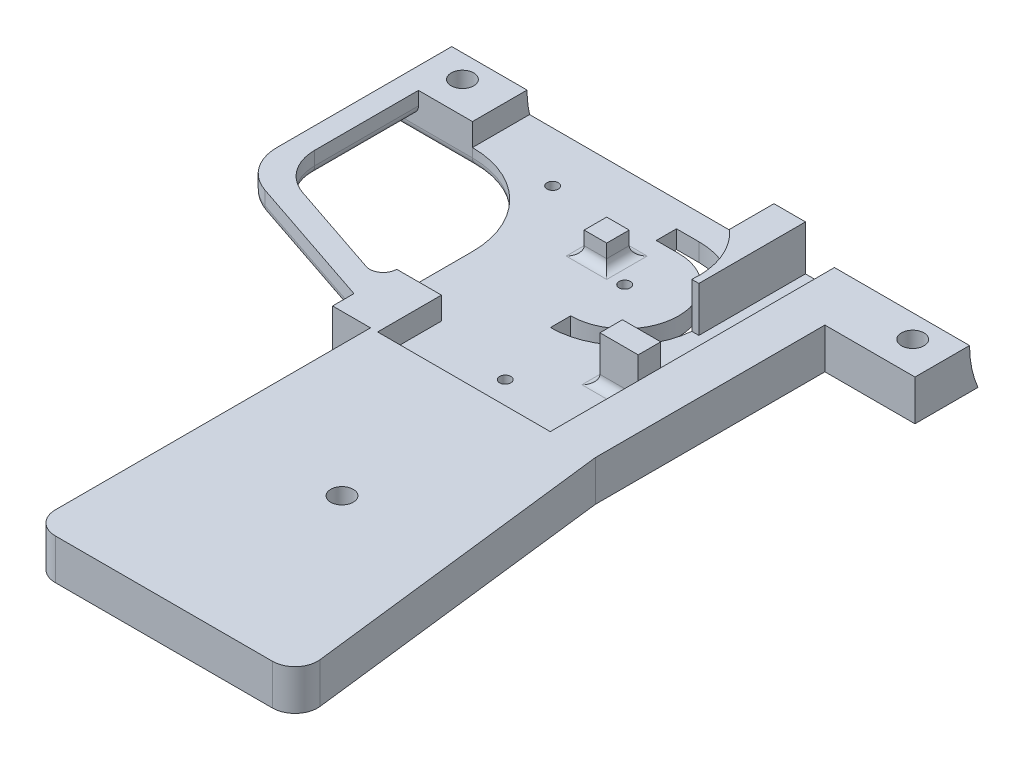
from build123d import *

# Parameters (mm, degrees)
SALIENTE_EXTRUIR1_DEPTH  = 4
REDONDEO1_R              = 20
REDONDEO2_R              = 10
REDONDEO3_R              = 3
CROQUIS2_R               = 1.25
CORTAR_EXTRUIR1_DEPTH    = 4
SALIENTE_EXTRUIR2_DEPTH  = 9
CROQUIS4_W               = 16.725121099
CROQUIS4_H               = 14
SALIENTE_EXTRUIR3_DEPTH  = 5
SALIENTE_EXTRUIR4_DEPTH  = 5
CORTAR_EXTRUIR2_START    = -4
CORTAR_EXTRUIR2_DEPTH    = 4
SALIENTE_EXTRUIR8_DEPTH  = 9
REDONDEO4_R              = 5
CORTAR_EXTRUIR3_DEPTH    = 115
CROQUIS11_R              = 2.5
CORTAR_EXTRUIR4_DEPTH    = 10
CROQUIS12_W              = 5
CROQUIS12_H              = 5
SALIENTE_EXTRUIR9_DEPTH  = 5
CROQUIS13_R              = 1.25
CROQUIS13_W              = 5
CROQUIS13_H              = 15
CORTAR_EXTRUIR5_DEPTH    = 10
SALIENTE_EXTRUIR10_START = 10
CROQUIS14_W              = 8.5
CROQUIS14_H              = 5
SALIENTE_EXTRUIR10_DEPTH = 10
REDONDEO5_R              = 2


with BuildPart() as part:
    # Croquis1 → Saliente-Extruir1 (new body)
    with BuildSketch(Plane(origin=(0, 0, 0), x_dir=(1, 0, 0), z_dir=(0, 1, 0))):
        Polygon((36.657146199, 0.467319271), (95, 0.467319271), (95, 65.467319271), (0, 65.467319271), (0, 17.557539605), (36.657146199, 5.214366653), align=None)
        Polygon((4.725121099, 51.467319271), (36.725121099, 51.467319271), (36.725121099, 10.467319271), (4.725121099, 21.242340663), align=None, mode=Mode.SUBTRACT)
    extrude(amount=SALIENTE_EXTRUIR1_DEPTH)

    # Redondeo1
    redondeo1_edges = [part.edges().sort_by_distance(p)[0] for p in [
        (36.725121099, 2, -51.467319271),
    ]]
    fillet(redondeo1_edges, radius=REDONDEO1_R)

    # Redondeo2
    redondeo2_edges = [part.edges().sort_by_distance(p)[0] for p in [
        (0, 2, -17.557539605),
        (4.725121099, 2, -21.242340663),
    ]]
    fillet(redondeo2_edges, radius=REDONDEO2_R)

    # Redondeo3
    redondeo3_edges = [part.edges().sort_by_distance(p)[0] for p in [
        (36.725121099, 2, -10.467319271),
    ]]
    fillet(redondeo3_edges, radius=REDONDEO3_R)

    # Croquis2 → Cortar-Extruir1 (cut)
    with BuildSketch(Plane(origin=(0, 4, 0), x_dir=(1, 0, 0), z_dir=(0, 1, 0))):
        with Locations(Location((33, 53, 0), (0, 0, 270))):
            Circle(CROQUIS2_R)
        with Locations(Location((65, 10.467319271, 0), (0, 0, 270))):
            Circle(CROQUIS2_R)
    extrude(amount=-CORTAR_EXTRUIR1_DEPTH, mode=Mode.SUBTRACT)

    # Croquis3 → Saliente-Extruir2 (add)
    with BuildSketch(Plane(origin=(0, 0, 0), x_dir=(1, 0, 0), z_dir=(0, 1, 0))):
        Polygon((115, 65.467319271), (115, 51.467319271), (95, 51.467319271), (95, 0.467319271), (85, 0.467319271), (85, 65.467319271), align=None)
    extrude(amount=SALIENTE_EXTRUIR2_DEPTH)

    # Croquis4 → Saliente-Extruir3 (add)
    with BuildSketch(Plane(origin=(0, 4, 0), x_dir=(1, 0, 0), z_dir=(0, 1, 0))):
        with Locations((8.36256055, 58.467319271)):
            Rectangle(CROQUIS4_W, CROQUIS4_H)
    extrude(amount=SALIENTE_EXTRUIR3_DEPTH)

    # Croquis5 → Saliente-Extruir4 (add)
    with BuildSketch(Plane(origin=(0, 9, 0), x_dir=(1, 0, 0), z_dir=(0, 1, 0))):
        with BuildLine():
            Line((11.533976664, 18.949666776), (32.767777769, 11.799833616))
            ThreePointArc((32.767777769, 11.799833616), (35.475545335, 12.206588327), (36.725121099, 14.642982178))
            Line((36.725121099, 14.642982178), (46.657146199, 14.642982178))
            Line((46.657146199, 14.642982178), (46.657146199, 0.467319271))
            Line((46.657146199, 0.467319271), (36.657146199, 0.467319271))
            Line((36.657146199, 0.467319271), (36.657146199, 5.214366653))
            Line((36.657146199, 5.214366653), (6.808855565, 15.264865719))
            ThreePointArc((6.808855565, 15.264865719), (1.878687164, 18.907280142), (0, 24.742027593))
            Line((0, 24.742027593), (0, 51.467319271))
            Line((0, 51.467319271), (4.725121099, 51.467319271))
            Line((4.725121099, 51.467319271), (4.725121099, 28.426828651))
            ThreePointArc((4.725121099, 28.426828651), (6.603808263, 22.592081199), (11.533976664, 18.949666776))
        make_face()
    extrude(amount=-SALIENTE_EXTRUIR4_DEPTH)

    # Cortar-Extruir2: read off the stored shape, not the designer's step
    # Cortar-Extruir2 outline → Cortar-Extruir2 (cut)
    with BuildSketch(Plane.XZ.offset(CORTAR_EXTRUIR2_START)):
        with BuildLine():
            Line((0, -51.467319271), (4.725121099, -51.467319271))
            Line((4.725121099, -51.467319271), (4.725121099, -28.426828651))
            ThreePointArc((4.725121099, -28.426828651), (6.603808263, -22.592081199), (11.533976664, -18.949666776))
            Line((11.533976664, -18.949666776), (32.767777769, -11.799833616))
            ThreePointArc((32.767777769, -11.799833616), (35.457935304, -12.194032416), (36.72480926, -14.599727874))
            Line((36.72480926, -14.599727874), (36.657146199, -5.214366653))
            Line((36.657146199, -5.214366653), (6.808855565, -15.264865719))
            ThreePointArc((6.808855565, -15.264865719), (1.878687164, -18.907280142), (0, -24.742027593))
            Line((0, -24.742027593), (0, -51.467319271))
        make_face()
    extrude(amount=CORTAR_EXTRUIR2_DEPTH, mode=Mode.SUBTRACT)

    # Croquis8 → Saliente-Extruir8 (add)
    with BuildSketch(Plane(origin=(0, 0, 0), x_dir=(1, 0, 0), z_dir=(0, 1, 0))):
        Polygon((45.084767614, -74.549161415), (103.968184017, -74.549161415), (95, 0.467319271), (85, 0.467319271), (46.657146199, 0.467319271), (45.084767614, 0.467319271), align=None)
    extrude(amount=SALIENTE_EXTRUIR8_DEPTH)

    # Redondeo4
    redondeo4_edges = [part.edges().sort_by_distance(p)[0] for p in [
        (45.084767614, 4.5, 74.549161415),
        (103.968184017, 4.5, 74.549161415),
    ]]
    fillet(redondeo4_edges, radius=REDONDEO4_R)

    # Croquis10 → Cortar-Extruir3 (cut)
    with BuildSketch(Plane(origin=(115, 0, 0), x_dir=(0, 0, -1), z_dir=(1, 0, 0))):
        with BuildLine():
            Line((65.467319271, 9), (65.467319271, 0))
            ThreePointArc((65.467319271, 0), (64.063517857, 4.403033017), (63.588909898, 9))
            Line((63.588909898, 9), (65.467319271, 9))
        make_face()
    extrude(amount=-CORTAR_EXTRUIR3_DEPTH, mode=Mode.SUBTRACT)

    # Croquis11 → Cortar-Extruir4 (cut)
    with BuildSketch(Plane.XZ):
        with Locations(Location((7.5, -58.467319271, 0), (0, 0, 270))):
            Circle(CROQUIS11_R)
        with Locations(Location((107.5, -58.467319271, 0), (0, 0, 270))):
            Circle(CROQUIS11_R)
        with Locations(Location((74.209800295, 35, 0), (0, 0, 270))):
            Circle(CROQUIS11_R)
    extrude(amount=-CORTAR_EXTRUIR4_DEPTH, mode=Mode.SUBTRACT)

    # Croquis12 → Saliente-Extruir9 (add)
    with BuildSketch(Plane(origin=(0, 4, 0), x_dir=(1, 0, 0), z_dir=(0, 1, 0))):
        with Locations((52.5, 45.5)):
            Rectangle(CROQUIS12_W, CROQUIS12_H)
    extrude(amount=SALIENTE_EXTRUIR9_DEPTH)

    # Croquis13 → Cortar-Extruir5 (cut)
    with BuildSketch(Plane(origin=(0, 4, 0), x_dir=(1, 0, 0), z_dir=(0, 1, 0))):
        with Locations(Location((60, 42, 0), (0, 0, 270))):
            Circle(CROQUIS13_R)
        with BuildLine():
            Line((60, 25.5), (60, 30))
            ThreePointArc((60, 30), (72, 42), (60, 54))
            Line((60, 54), (55, 54))
            Line((55, 54), (55, 58.5))
            Line((55, 58.5), (60, 58.5))
            ThreePointArc((60, 58.5), (76.5, 42), (60, 25.5))
        make_face()
        with Locations((82.5, 47.967319271)):
            Rectangle(CROQUIS13_W, CROQUIS13_H)
    extrude(amount=-CORTAR_EXTRUIR5_DEPTH, mode=Mode.SUBTRACT)

    # Croquis14 → Saliente-Extruir10 (add)
    with BuildSketch(Plane(origin=(0, 4, 0), x_dir=(1, 0, 0), z_dir=(0, 1, 0)).offset(SALIENTE_EXTRUIR10_START)):
        with BuildLine():
            Line((78, 40.467319271), (76.42866062, 40.467319271))
            ThreePointArc((76.42866062, 40.467319271), (75.359276472, 48.028484575), (71, 54.298373876))
            Line((71, 54.298373876), (71, 64.151498929))
            Line((71, 64.151498929), (78, 64.151498929))
            Line((78, 64.151498929), (78, 40.467319271))
        make_face()
        with Locations((80.75, 22.5)):
            Rectangle(CROQUIS14_W, CROQUIS14_H)
    extrude(amount=-SALIENTE_EXTRUIR10_DEPTH)

    # Redondeo5
    # the kernel refuses this fillet: 2 mm, written as the material it adds along each edge
    with BuildSketch(Plane(origin=(50, 4, -43), x_dir=(-1, 0, 0), z_dir=(0, 0, -1)), Plane(origin=(55, 4, -43), x_dir=(0, 0, 1), z_dir=(-1, 0, 0)), Plane(origin=(55, 4, -48), x_dir=(1, 0, 0), z_dir=(0, 0, 1)), Plane(origin=(50, 4, -48), x_dir=(0, 0, -1), z_dir=(1, 0, 0))) as redondeo5_piece_1:
        with BuildLine():
            CenterArc((REDONDEO5_R, REDONDEO5_R), REDONDEO5_R, 180, 90)
            Line((0, REDONDEO5_R), (0, 0))
            Line((0, 0), (REDONDEO5_R, 0))
        make_face()
    extrude(amount=5)
    with BuildSketch(Plane(origin=(76.5, 4, -25), x_dir=(-1, 0, 0), z_dir=(0, 0, 1))) as redondeo5_piece_2:
        with BuildLine():
            CenterArc((REDONDEO5_R, -REDONDEO5_R), REDONDEO5_R, 90, 90)
            Line((0, -REDONDEO5_R), (0, 0))
            Line((0, 0), (REDONDEO5_R, 0))
        make_face()
    extrude(amount=5)
    with BuildSketch(Plane(origin=(76.5, 4, -20), x_dir=(0, 0, 1), z_dir=(1, 0, 0))) as redondeo5_piece_3:
        with BuildLine():
            CenterArc((REDONDEO5_R, -REDONDEO5_R), REDONDEO5_R, 90, 90)
            Line((0, -REDONDEO5_R), (0, 0))
            Line((0, 0), (REDONDEO5_R, 0))
        make_face()
    extrude(amount=13.5)
    with BuildSketch(Plane(origin=(50, 4, -38), x_dir=(-1, 0, 0), z_dir=(0, 0, -1))) as redondeo5_piece_4a_section:
        with BuildLine():
            CenterArc((REDONDEO5_R, REDONDEO5_R), REDONDEO5_R, 180, 90)
            Line((0, REDONDEO5_R), (0, 0))
            Line((0, 0), (REDONDEO5_R, 0))
        make_face()
    redondeo5_piece_4a = extrude(amount=10, mode=Mode.PRIVATE)
    redondeo5_piece_4a = split(redondeo5_piece_4a, bisect_by=Plane(origin=(50, 4, -43), z_dir=(0, 0, 1)), keep=Keep.TOP, mode=Mode.PRIVATE)
    with BuildSketch(Plane(origin=(55, 4, -43), x_dir=(0, 0, 1), z_dir=(-1, 0, 0))) as redondeo5_piece_4b_section:
        with BuildLine():
            CenterArc((REDONDEO5_R, REDONDEO5_R), REDONDEO5_R, 180, 90)
            Line((0, REDONDEO5_R), (0, 0))
            Line((0, 0), (REDONDEO5_R, 0))
        make_face()
    redondeo5_piece_4b = extrude(amount=10, mode=Mode.PRIVATE)
    redondeo5_piece_4b = split(redondeo5_piece_4b, bisect_by=Plane(origin=(50, 4, -43), z_dir=(-1, 0, 0)), keep=Keep.TOP, mode=Mode.PRIVATE)
    redondeo5_piece_4 = redondeo5_piece_4a & redondeo5_piece_4b
    add(redondeo5_piece_4)
    with BuildSketch(Plane(origin=(50, 4, -43), x_dir=(-1, 0, 0), z_dir=(0, 0, -1))) as redondeo5_piece_5a_section:
        with BuildLine():
            CenterArc((REDONDEO5_R, REDONDEO5_R), REDONDEO5_R, 180, 90)
            Line((0, REDONDEO5_R), (0, 0))
            Line((0, 0), (REDONDEO5_R, 0))
        make_face()
    redondeo5_piece_5a = extrude(amount=10, mode=Mode.PRIVATE)
    redondeo5_piece_5a = split(redondeo5_piece_5a, bisect_by=Plane(origin=(50, 4, -48), z_dir=(0, 0, -1)), keep=Keep.TOP, mode=Mode.PRIVATE)
    with BuildSketch(Plane(origin=(45, 4, -48), x_dir=(0, 0, -1), z_dir=(1, 0, 0))) as redondeo5_piece_5b_section:
        with BuildLine():
            CenterArc((REDONDEO5_R, REDONDEO5_R), REDONDEO5_R, 180, 90)
            Line((0, REDONDEO5_R), (0, 0))
            Line((0, 0), (REDONDEO5_R, 0))
        make_face()
    redondeo5_piece_5b = extrude(amount=10, mode=Mode.PRIVATE)
    redondeo5_piece_5b = split(redondeo5_piece_5b, bisect_by=Plane(origin=(50, 4, -48), z_dir=(-1, 0, 0)), keep=Keep.TOP, mode=Mode.PRIVATE)
    redondeo5_piece_5 = redondeo5_piece_5a & redondeo5_piece_5b
    add(redondeo5_piece_5)
    with BuildSketch(Plane(origin=(60, 4, -43), x_dir=(0, 0, 1), z_dir=(-1, 0, 0))) as redondeo5_piece_6a_section:
        with BuildLine():
            CenterArc((REDONDEO5_R, REDONDEO5_R), REDONDEO5_R, 180, 90)
            Line((0, REDONDEO5_R), (0, 0))
            Line((0, 0), (REDONDEO5_R, 0))
        make_face()
    redondeo5_piece_6a = extrude(amount=10, mode=Mode.PRIVATE)
    redondeo5_piece_6a = redondeo5_piece_6a - Plane(origin=(60, 4, -42), x_dir=(0, 0, 1), z_dir=(0, 1, 0)) * Cylinder(1.25, 28, mode=Mode.PRIVATE)
    redondeo5_piece_6a = split(redondeo5_piece_6a, bisect_by=Plane(origin=(55, 4, -43), z_dir=(1, 0, 0)), keep=Keep.TOP, mode=Mode.PRIVATE)
    with BuildSketch(Plane(origin=(55, 4, -48), x_dir=(1, 0, 0), z_dir=(0, 0, 1))) as redondeo5_piece_6b_section:
        with BuildLine():
            CenterArc((REDONDEO5_R, REDONDEO5_R), REDONDEO5_R, 180, 90)
            Line((0, REDONDEO5_R), (0, 0))
            Line((0, 0), (REDONDEO5_R, 0))
        make_face()
    redondeo5_piece_6b = extrude(amount=10, mode=Mode.PRIVATE)
    redondeo5_piece_6b = split(redondeo5_piece_6b, bisect_by=Plane(origin=(55, 4, -43), z_dir=(0, 0, 1)), keep=Keep.TOP, mode=Mode.PRIVATE)
    redondeo5_piece_6 = redondeo5_piece_6a & redondeo5_piece_6b
    add(redondeo5_piece_6)
    with BuildSketch(Plane(origin=(50, 4, -48), x_dir=(0, 0, -1), z_dir=(1, 0, 0))) as redondeo5_piece_7a_section:
        with BuildLine():
            CenterArc((REDONDEO5_R, REDONDEO5_R), REDONDEO5_R, 180, 90)
            Line((0, REDONDEO5_R), (0, 0))
            Line((0, 0), (REDONDEO5_R, 0))
        make_face()
    redondeo5_piece_7a = extrude(amount=10, mode=Mode.PRIVATE)
    redondeo5_piece_7a = split(redondeo5_piece_7a, bisect_by=Plane(origin=(55, 4, -48), z_dir=(1, 0, 0)), keep=Keep.TOP, mode=Mode.PRIVATE)
    with BuildSketch(Plane(origin=(55, 4, -53), x_dir=(1, 0, 0), z_dir=(0, 0, 1))) as redondeo5_piece_7b_section:
        with BuildLine():
            CenterArc((REDONDEO5_R, REDONDEO5_R), REDONDEO5_R, 180, 90)
            Line((0, REDONDEO5_R), (0, 0))
            Line((0, 0), (REDONDEO5_R, 0))
        make_face()
    redondeo5_piece_7b = extrude(amount=10, mode=Mode.PRIVATE)
    redondeo5_piece_7b = split(redondeo5_piece_7b, bisect_by=Plane(origin=(55, 4, -48), z_dir=(0, 0, -1)), keep=Keep.TOP, mode=Mode.PRIVATE)
    redondeo5_piece_7 = redondeo5_piece_7a & redondeo5_piece_7b
    add(redondeo5_piece_7)
    with BuildSketch(Plane(origin=(76.5, 4, -25), x_dir=(-1, 0, 0), z_dir=(0, 0, 1))) as redondeo5_piece_8a_section:
        with BuildLine():
            CenterArc((REDONDEO5_R, -REDONDEO5_R), REDONDEO5_R, 90, 90)
            Line((0, -REDONDEO5_R), (0, 0))
            Line((0, 0), (REDONDEO5_R, 0))
        make_face()
    redondeo5_piece_8a = extrude(amount=10, mode=Mode.PRIVATE)
    redondeo5_piece_8a = split(redondeo5_piece_8a, bisect_by=Plane(origin=(76.5, 4, -20), z_dir=(0, 0, 1)), keep=Keep.TOP, mode=Mode.PRIVATE)
    with BuildSketch(Plane(origin=(71.5, 4, -20), x_dir=(0, 0, 1), z_dir=(1, 0, 0))) as redondeo5_piece_8b_section:
        with BuildLine():
            CenterArc((REDONDEO5_R, -REDONDEO5_R), REDONDEO5_R, 90, 90)
            Line((0, -REDONDEO5_R), (0, 0))
            Line((0, 0), (REDONDEO5_R, 0))
        make_face()
    redondeo5_piece_8b = extrude(amount=13.5, mode=Mode.PRIVATE)
    redondeo5_piece_8b = split(redondeo5_piece_8b, bisect_by=Plane(origin=(76.5, 4, -20), z_dir=(-1, 0, 0)), keep=Keep.TOP, mode=Mode.PRIVATE)
    redondeo5_piece_8 = redondeo5_piece_8a & redondeo5_piece_8b
    add(redondeo5_piece_8)
    # the kernel refuses this fillet: 2 mm, written as the material it takes off along each edge
    with BuildSketch(Plane(origin=(33.725121099, 0, -14.642982178), x_dir=(-0.11006554678443577, 0, 0.9939243308275753), z_dir=(-0.9939243308275753, 0, -0.11006554678443577))) as redondeo5_2_piece_1:
        with BuildLine():
            CenterArc((3 + REDONDEO5_R, REDONDEO5_R), REDONDEO5_R, 180, 90)
            Line((3, REDONDEO5_R), (3, 0))
            Line((3, 0), (3 + REDONDEO5_R, 0))
        make_face()
    revolve(axis=Axis((33.725121099, 0, -14.642982178), (0, 1, 0)), revolution_arc=96.319094067, mode=Mode.SUBTRACT)
    with BuildSketch(Plane(origin=(33.725121101, 4, -14.642982175), x_dir=(-0.31911444425993896, 0, 0.9477161871914347), z_dir=(-0.9477161871914347, 0, -0.31911444425993896))) as redondeo5_2_piece_2_section:
        with BuildLine():
            CenterArc((2.999999998 + REDONDEO5_R, REDONDEO5_R), REDONDEO5_R, 180, 90)
            Line((2.999999998 - REDONDEO5_R * 4.36444880236e-10, REDONDEO5_R), (2.999999998, 0))
            Line((2.999999998, 0), (2.999999998 + REDONDEO5_R, 0))
        make_face()
    redondeo5_2_piece_2 = revolve(axis=Axis((33.725121101, 4, -14.642982175), (0, 1, 0)), revolution_arc=203.331243748, mode=Mode.PRIVATE)
    redondeo5_2_piece_2 = split(redondeo5_2_piece_2, bisect_by=Plane(origin=(36.724965179, 4, -14.621355023), z_dir=(-0.9999740131061556, 0, -0.007209237988178882)), keep=Keep.TOP, mode=Mode.PRIVATE)
    add(redondeo5_2_piece_2, mode=Mode.SUBTRACT)
    with BuildSketch(Plane(origin=(11.533976664, 4, -18.949666776), x_dir=(-0.3191144435113306, 0, 0.9477161874435056), z_dir=(0.9477161874435056, 0, 0.3191144435113306))) as redondeo5_2_piece_3:
        with BuildLine():
            CenterArc((REDONDEO5_R, -REDONDEO5_R), REDONDEO5_R, 90, 90)
            Line((0, -REDONDEO5_R), (0, 0))
            Line((0, 0), (REDONDEO5_R, 0))
        make_face()
    extrude(amount=22.405232058, mode=Mode.SUBTRACT)
    with BuildSketch(Plane(origin=(14.725121098, 4, -28.42682865), x_dir=(-1.0, 0, -9.385345834372306e-11), z_dir=(9.385345834372306e-11, 0, -1.0))) as redondeo5_2_piece_4:
        with BuildLine():
            CenterArc((9.999999999 + REDONDEO5_R, REDONDEO5_R), REDONDEO5_R, 180, 90)
            Line((9.999999999 - REDONDEO5_R * 2.13431050611e-10, REDONDEO5_R), (9.999999999, 0))
            Line((9.999999999, 0), (9.999999999 + REDONDEO5_R, 0))
        make_face()
    revolve(axis=Axis((14.725121098, 4, -28.42682865), (0, 1, 0)), revolution_arc=71.390621366, mode=Mode.SUBTRACT)
    with BuildSketch(Plane(origin=(4.725121099, 4, -51.467319271), x_dir=(1.166040597411211e-10, 1.0, 0), z_dir=(0, 0, 1))) as redondeo5_2_piece_5:
        with BuildLine():
            CenterArc((REDONDEO5_R, REDONDEO5_R), REDONDEO5_R, 180.000000007, 90)
            Line((-REDONDEO5_R * 1.16604059728e-10, REDONDEO5_R), (0, 0))
            Line((0, 0), (REDONDEO5_R, 0))
        make_face()
    extrude(amount=23.04049062, mode=Mode.SUBTRACT)
    with BuildSketch(Plane(origin=(0, 4, -24.742027593), x_dir=(1, 0, 0), z_dir=(0, 0, -1))) as redondeo5_2_piece_6:
        with BuildLine():
            CenterArc((REDONDEO5_R, -REDONDEO5_R), REDONDEO5_R, 90, 90)
            Line((0, -REDONDEO5_R), (0, 0))
            Line((0, 0), (REDONDEO5_R, 0))
        make_face()
    extrude(amount=26.725291678, mode=Mode.SUBTRACT)
    with BuildSketch(Plane(origin=(9.999999999, 4, -24.742027593), x_dir=(-0.3191144434609789, 0, 0.9477161874604599), z_dir=(0.9477161874604599, 0, 0.3191144434609789))) as redondeo5_2_piece_7:
        with BuildLine():
            CenterArc((9.999999999 - REDONDEO5_R, -REDONDEO5_R), REDONDEO5_R, 0, 90)
            Line((9.999999999 + REDONDEO5_R * 5.85504977835e-11, -REDONDEO5_R), (9.999999999, 0))
            Line((9.999999999, 0), (9.999999999 - REDONDEO5_R, 0))
        make_face()
    revolve(axis=Axis((9.999999999, 4, -24.742027593), (0, -1, 0)), revolution_arc=71.390621361, mode=Mode.SUBTRACT)
    with BuildSketch(Plane(origin=(41.395727136, 4, -3.618794435), x_dir=(0.31911444355046886, 0, -0.9477161874303269), z_dir=(-0.9477161874303269, 0, -0.31911444355046886))) as redondeo5_2_piece_8_section:
        with BuildLine():
            CenterArc((REDONDEO5_R, -REDONDEO5_R), REDONDEO5_R, 90, 90)
            Line((-REDONDEO5_R * 9.41127960718e-11, -REDONDEO5_R), (0, 0))
            Line((0, 0), (REDONDEO5_R, 0))
        make_face()
    redondeo5_2_piece_8 = extrude(amount=36.494967618, mode=Mode.PRIVATE)
    redondeo5_2_piece_8 = split(redondeo5_2_piece_8, bisect_by=Plane(origin=(36.645889917, 4, -3.653038032), z_dir=(-0.9999740131061556, 0, -0.007209237988178882)), keep=Keep.TOP, mode=Mode.PRIVATE)
    add(redondeo5_2_piece_8, mode=Mode.SUBTRACT)
    with BuildSketch(Plane(origin=(16.725121099, 0, -51.467319271), x_dir=(2.1424885652254232e-11, 0, -1.0), z_dir=(-1.0, 0, -2.1424885652254232e-11))) as redondeo5_2_piece_9:
        with BuildLine():
            CenterArc((REDONDEO5_R, -REDONDEO5_R), REDONDEO5_R, 90, 90)
            Line((-REDONDEO5_R * 8.95887808379e-11, -REDONDEO5_R), (0, 0))
            Line((0, 0), (REDONDEO5_R, 0))
        make_face()
    extrude(amount=21.725121099, mode=Mode.SUBTRACT)
    with BuildSketch(Plane(origin=(16.725121099, 0, -31.467319271), x_dir=(0, 0, -1), z_dir=(-1, 0, 0))) as redondeo5_2_piece_10:
        with BuildLine():
            CenterArc((20 + REDONDEO5_R, -REDONDEO5_R), REDONDEO5_R, 90, 90)
            Line((20, -REDONDEO5_R), (20, 0))
            Line((20, 0), (20 + REDONDEO5_R, 0))
        make_face()
    revolve(axis=Axis((16.725121099, 0, -31.467319271), (0, -1, 0)), revolution_arc=90, mode=Mode.SUBTRACT)
    with BuildSketch(Plane(origin=(36.725121099, 0, -31.467319271), x_dir=(1, 0, 0), z_dir=(0, 0, 1))) as redondeo5_2_piece_11:
        with BuildLine():
            CenterArc((REDONDEO5_R, REDONDEO5_R), REDONDEO5_R, 180, 90)
            Line((0, REDONDEO5_R), (0, 0))
            Line((0, 0), (REDONDEO5_R, 0))
        make_face()
    extrude(amount=16.824337093, mode=Mode.SUBTRACT)


solid = part.part
